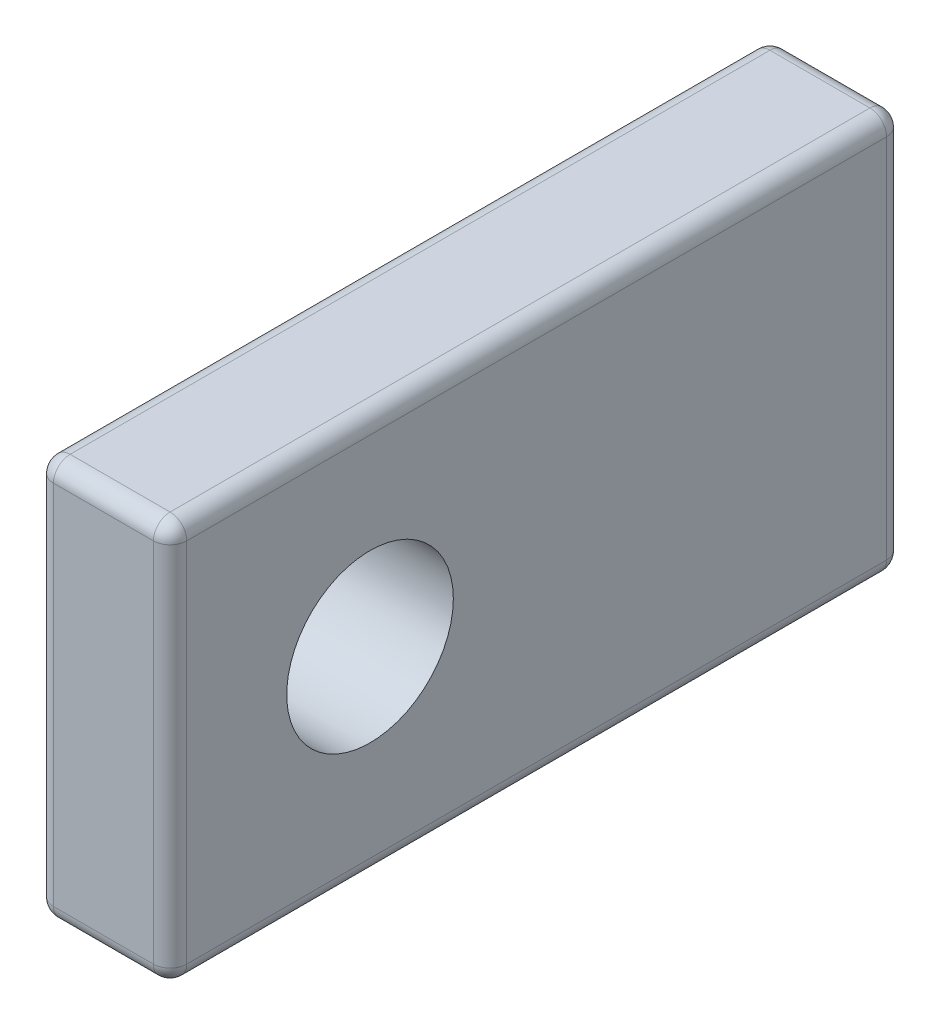
from build123d import *

# Parameters (mm, degrees)
SKETCH2_W           = 34.925
SKETCH2_H           = 19.05
SKETCH2_R           = 3.96875
BOSS_EXTRUDE1_DEPTH = 3.175
FILLET1_R           = 0.79375


with BuildPart() as part:
    # Sketch2 → Boss-Extrude1 (new, symmetric)
    with BuildSketch(Plane(origin=(0, 0, 0), x_dir=(0, 0, -1), z_dir=(1, 0, 0))):
        with Locations((7.9375, 0)):
            Rectangle(SKETCH2_W, SKETCH2_H)
        Circle(SKETCH2_R, mode=Mode.SUBTRACT)
    extrude(amount=BOSS_EXTRUDE1_DEPTH, both=True)

    # Fillet1
    fillet1_edges = [part.edges().sort_by_distance(p)[0] for p in [
        (-3.175, -9.525, -7.9375),
        (0, -9.525, -25.4),
        (0, 9.525, -25.4),
        (-3.175, 9.525, -7.9375),
        (-3.175, 0, -25.4),
        (3.175, 0, -25.4),
        (3.175, -9.525, -7.9375),
        (0, -9.525, 9.525),
        (-3.175, 0, 9.525),
        (3.175, 0, 9.525),
        (0, 9.525, 9.525),
        (3.175, 9.525, -7.9375),
    ]]
    fillet(fillet1_edges, radius=FILLET1_R)


solid = part.part
